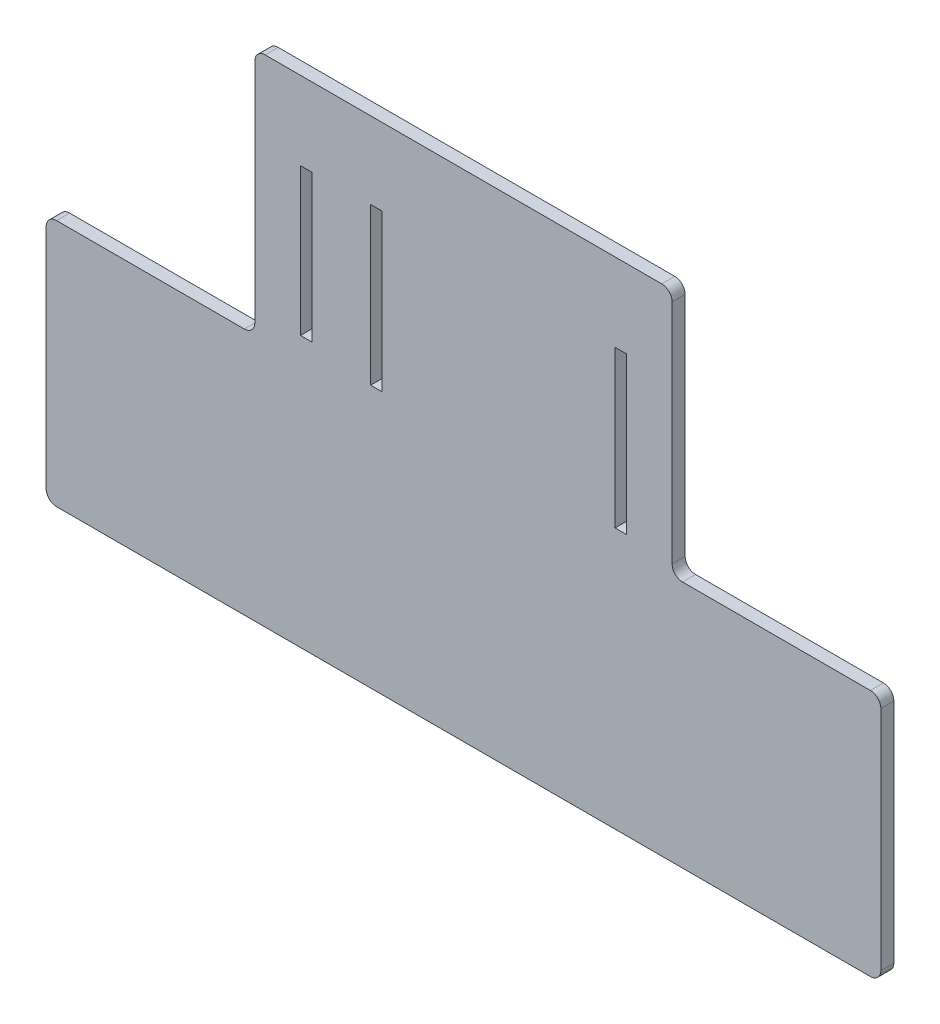
from build123d import *

# Parameters (mm, degrees)
BOSS_EXTRUDE1_DEPTH    = 3.175
FILLET1_R              = 2.54
SKETCH2_W              = 2.794
SKETCH2_H              = 38.1
CUT_EXTRUDE1_DEPTH     = 3.175
CUT_EXTRUDE2_START     = -3.175
CUT_EXTRUDE2_OUTLINE_W = 2.794
CUT_EXTRUDE2_OUTLINE_H = 35.802572731
CUT_EXTRUDE2_DEPTH     = 3.175
SKETCH4_W              = 2.794
SKETCH4_H              = 38.1
CUT_EXTRUDE3_DEPTH     = 3.175


# Read off the part's stored shape, not the designer's step: Cut-Extrude2
with BuildPart() as part:
    # Sketch1 → Boss-Extrude1 (new body)
    with BuildSketch(Plane.XY):
        Polygon((28.434847271, 23.464502165), (79.234847271, 23.464502165), (79.234847271, -36.860497835), (-123.965152729, -36.860497835), (-123.965152729, 23.464502165), (-73.165152729, 23.464502165), (-73.165152729, 83.789502165), (28.434847271, 83.789502165), align=None)
    extrude(amount=BOSS_EXTRUDE1_DEPTH)

    # Fillet1
    fillet1_edges = [part.edges().sort_by_distance(p)[0] for p in [
        (-123.965152729, 23.464502165, 1.5875),
        (-73.165152729, 23.464502165, 1.5875),
        (-73.165152729, 83.789502165, 1.5875),
        (28.434847271, 83.789502165, 1.5875),
        (28.434847271, 23.464502165, 1.5875),
        (79.234847271, 23.464502165, 1.5875),
        (79.234847271, -36.860497835, 1.5875),
        (-123.965152729, -36.860497835, 1.5875),
    ]]
    fillet(fillet1_edges, radius=FILLET1_R)

    # Sketch2 → Cut-Extrude1 (cut)
    with BuildSketch(Plane.XY.offset(3.175)):
        with Locations((15.925347271, 45.689502165)):
            Rectangle(SKETCH2_W, SKETCH2_H)
    extrude(amount=-CUT_EXTRUDE1_DEPTH, mode=Mode.SUBTRACT)

    # Cut-Extrude2 outline → Cut-Extrude2 (cut)
    with BuildSketch(Plane.XY.offset(3.175).offset(CUT_EXTRUDE2_START)):
        with Locations((-60.655652729, 46.8382158)):
            Rectangle(CUT_EXTRUDE2_OUTLINE_W, CUT_EXTRUDE2_OUTLINE_H)
    extrude(amount=CUT_EXTRUDE2_DEPTH, mode=Mode.SUBTRACT)

    # Sketch4 → Cut-Extrude3 (cut)
    with BuildSketch(Plane.XY.offset(3.175)):
        with Locations((-43.574152729, 46.047516436)):
            Rectangle(SKETCH4_W, SKETCH4_H)
    extrude(amount=-CUT_EXTRUDE3_DEPTH, mode=Mode.SUBTRACT)


solid = part.part
